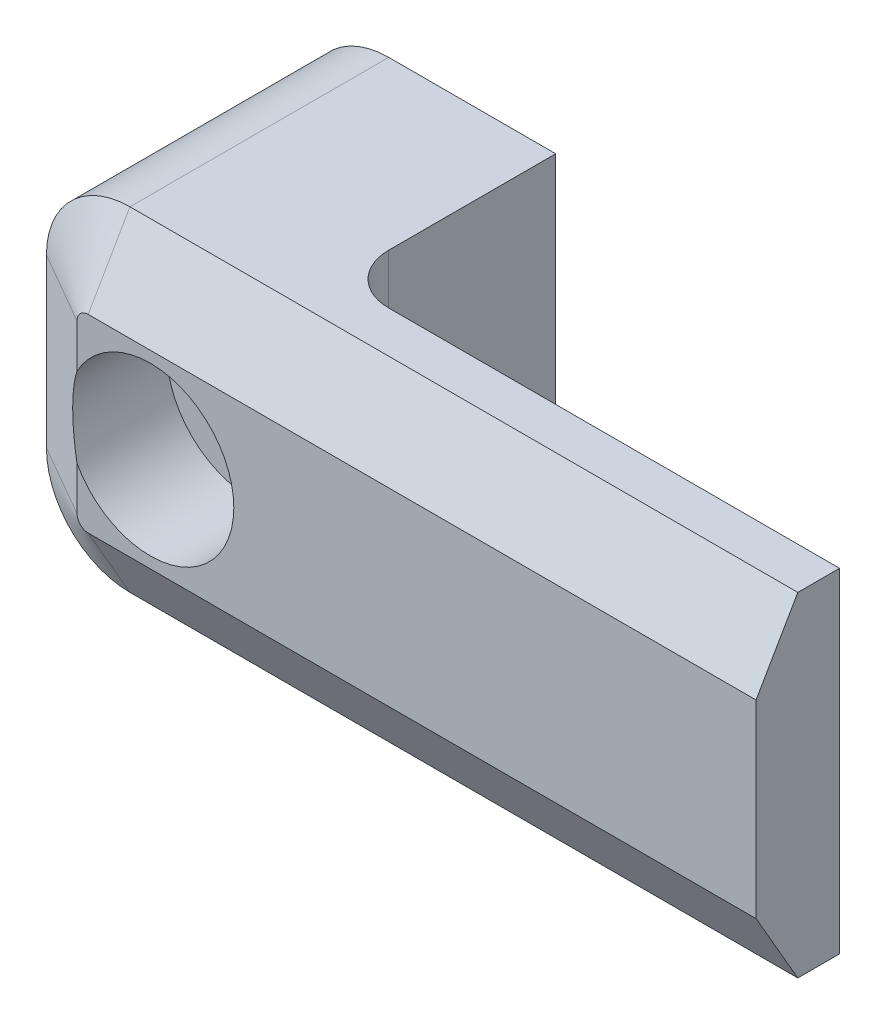
from build123d import *

# Parameters (mm, degrees)
SKETCH1_W       = 45
SKETCH1_H       = 20
EXTRUDE1_DEPTH  = 5
SKETCH2_W       = 15
SKETCH2_H       = 20
EXTRUDE2_DEPTH  = 13
SKETCH3_R       = 5
EXTRUDE3_DEPTH  = 6
SKETCH4_R       = 2.5
EXTRUDE4_DEPTH  = 16
FILLET1_R       = 5
CHAMFER1_SIZE   = 4.330127019
CHAMFER1_SIZE_2 = 2.5
FILLET2_R       = 3


with BuildPart() as part:
    # Sketch1 → Extrude1 (new body)
    with BuildSketch(Plane.XY):
        Rectangle(SKETCH1_W, SKETCH1_H)
    extrude(amount=EXTRUDE1_DEPTH)

    # Sketch2 → Extrude2 (add)
    with BuildSketch(Plane(origin=(0, 0, 0), x_dir=(-1, 0, 0), z_dir=(0, 0, -1))):
        with Locations((15, 0)):
            Rectangle(SKETCH2_W, SKETCH2_H)
    extrude(amount=EXTRUDE2_DEPTH)

    # Sketch3 → Extrude3 (cut)
    with BuildSketch(Plane.XY.offset(5)):
        with Locations((-13.77840955, 0)):
            Circle(SKETCH3_R)
    extrude(amount=-EXTRUDE3_DEPTH, mode=Mode.SUBTRACT)

    # Sketch4 → Extrude4 (cut)
    with BuildSketch(Plane.XY.offset(-1)):
        with Locations((-13.77840955, 0)):
            Circle(SKETCH4_R)
    extrude(amount=-EXTRUDE4_DEPTH, mode=Mode.SUBTRACT)

    # Fillet1
    fillet1_edges = [part.edges().sort_by_distance(p)[0] for p in [
        (-22.5, 10, -4),
        (-22.5, -10, -4),
    ]]
    fillet(fillet1_edges, radius=FILLET1_R)

    # Chamfer1
    # the kernel refuses this chamfer: 4.330127019, 2.5 mm, written as the material it takes off along each edge
    with BuildSketch(Plane(origin=(-17.5, 10, 5), x_dir=(0, -0.999813220622208, 0.01932676561270069), z_dir=(1, 0, 0))) as chamfer1_piece_1:
        Polygon((CHAMFER1_SIZE * 0.999813220604, CHAMFER1_SIZE * 0.0193267656124), (-CHAMFER1_SIZE_2 * 0.0193267656127, CHAMFER1_SIZE_2 * 0.999813220622), (0, 0), align=None)
    extrude(amount=51.202409926, mode=Mode.SUBTRACT)
    with BuildSketch(Plane(origin=(33.702409926, -10, 5), x_dir=(0, -0.05789386240267114, -0.9983227437537926), z_dir=(-1, 0, 0))) as chamfer1_piece_2:
        Polygon((CHAMFER1_SIZE_2 * 0.998322743754, -CHAMFER1_SIZE_2 * 0.0578938624027), (-CHAMFER1_SIZE * 0.0578938624016, -CHAMFER1_SIZE * 0.998322743736), (0, 0), align=None)
    extrude(amount=51.202409926, mode=Mode.SUBTRACT)
    with BuildSketch(Plane(origin=(-22.5, -5, 5), x_dir=(0.999813220622208, 0, 0.01932676561270069), z_dir=(0, 1, 0))) as chamfer1_piece_3:
        Polygon((CHAMFER1_SIZE * 0.999813220604, CHAMFER1_SIZE * 0.0193267656124), (-CHAMFER1_SIZE_2 * 0.0193267656127, CHAMFER1_SIZE_2 * 0.999813220622), (0, 0), align=None)
    extrude(amount=10, mode=Mode.SUBTRACT)
    with BuildSketch(Plane(origin=(-17.5, 5, 5), x_dir=(-1, 0, 0), z_dir=(0, -1, 0))) as chamfer1_piece_4:
        Polygon((5 - CHAMFER1_SIZE, 0), (5, CHAMFER1_SIZE_2), (5, 0), align=None)
    revolve(axis=Axis((-17.5, 5, 5), (0, 0, -1)), revolution_arc=90, mode=Mode.SUBTRACT)
    with BuildSketch(Plane(origin=(-17.5, -5, 5), x_dir=(0, -1, 0), z_dir=(1, 0, 0))) as chamfer1_piece_5:
        Polygon((5 - CHAMFER1_SIZE, 0), (5, CHAMFER1_SIZE_2), (5, 0), align=None)
    revolve(axis=Axis((-17.5, -5, 5), (0, 0, -1)), revolution_arc=90, mode=Mode.SUBTRACT)

    # Fillet2
    fillet2_edges = [part.edges().sort_by_distance(p)[0] for p in [
        (-7.5, 0, 0),
    ]]
    fillet(fillet2_edges, radius=FILLET2_R)


solid = part.part
